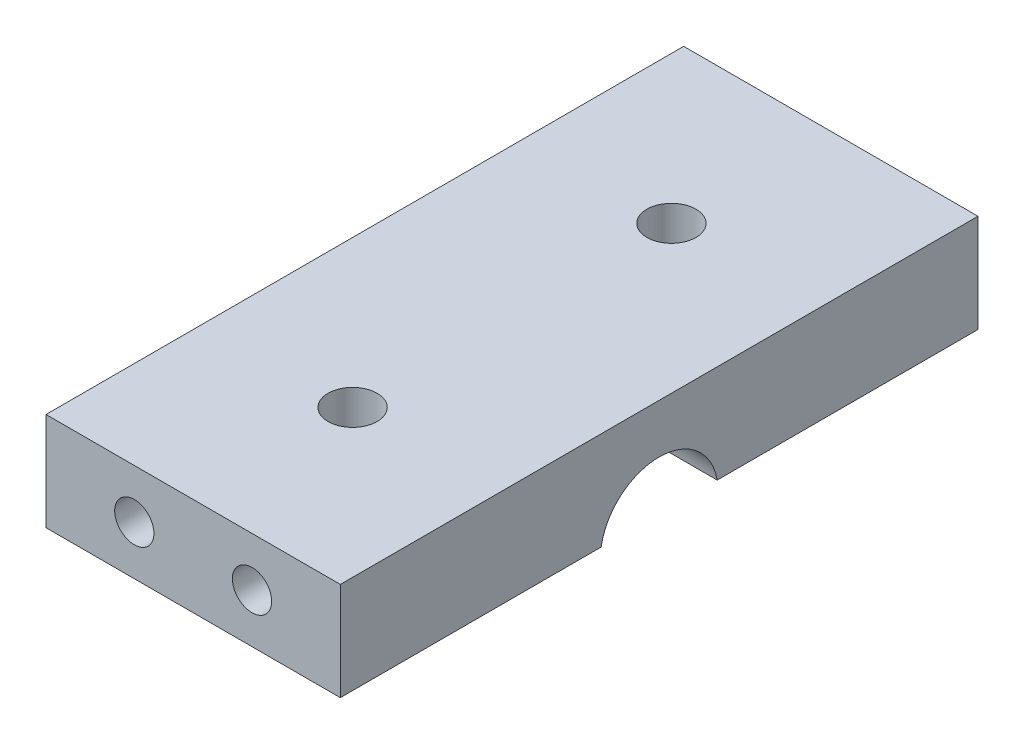
from build123d import *

# Parameters (mm, degrees)
SKETCH_1_W            = 30
SKETCH_1_H            = 65
EXTRUDE_1_DEPTH       = 10
SKETCH_2_R            = 6
CUT_EXTRUDE_2_DEPTH   = 73.284161474
SKETCH_3_R            = 2.5
CUT_EXTRUDE_3_DEPTH   = 73.284161474
SKETCH_4_R            = 2
CUT_EXTRUDE_1_DEPTH   = 20
CUT_EXTRUDE_START     = -20
SKETCH_5_R            = 2
CUT_EXTRUDE_2_2_DEPTH = 20


with BuildPart() as part:
    # Эскиз1 → Вытянуть1 (new body)
    with BuildSketch(Plane(origin=(0, 0, 0), x_dir=(1, 0, 0), z_dir=(0, 1, 0))):
        with Locations((15, 32.5)):
            Rectangle(SKETCH_1_W, SKETCH_1_H)
    extrude(amount=EXTRUDE_1_DEPTH)

    # Эскиз2 → Cut-Extrude 2 (cut, through all)
    with BuildSketch(Plane(origin=(30, 0, 0), x_dir=(0, 0, -1), z_dir=(1, 0, 0))):
        with Locations((32.5, -1)):
            Circle(SKETCH_2_R)
    extrude(amount=-CUT_EXTRUDE_2_DEPTH, mode=Mode.SUBTRACT)

    # Эскиз3 → Вытянуть3 (cut, through all)
    with BuildSketch(Plane(origin=(0, 10, 0), x_dir=(1, 0, 0), z_dir=(0, 1, 0))):
        with Locations((15, 48.75)):
            Circle(SKETCH_3_R)
        with Locations((15, 16.25)):
            Circle(SKETCH_3_R)
    extrude(amount=-CUT_EXTRUDE_3_DEPTH, mode=Mode.SUBTRACT)

    # Эскиз4 → Вырез-Вытянуть1 (cut)
    with BuildSketch(Plane.XY):
        with Locations((9, 5.000000757)):
            Circle(SKETCH_4_R)
        with Locations((21, 5.000000757)):
            Circle(SKETCH_4_R)
    extrude(amount=-CUT_EXTRUDE_1_DEPTH, mode=Mode.SUBTRACT)

    # Эскиз5 → Cut-Extrude 2 2 (cut)
    with BuildSketch(Plane(origin=(0, 0, -65), x_dir=(-1, 0, 0), z_dir=(0, 0, -1)).offset(CUT_EXTRUDE_START)):
        with Locations((-20.999999999, 5.000000369)):
            Circle(SKETCH_5_R)
        with Locations((-8.999999999, 5.000000369)):
            Circle(SKETCH_5_R)
    extrude(amount=CUT_EXTRUDE_2_2_DEPTH, mode=Mode.SUBTRACT)


solid = part.part
